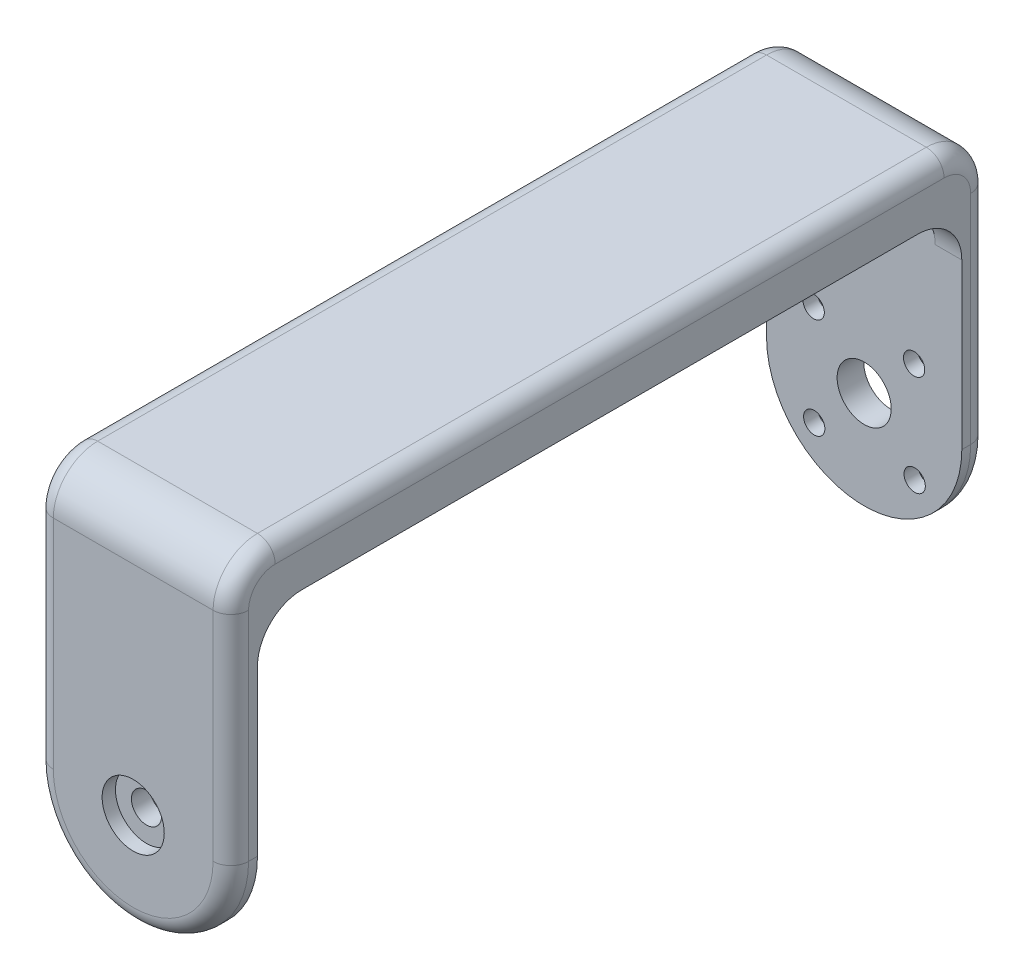
from build123d import *

# Parameters (mm, degrees)
ESBO_O1_R                                            = 3.05
RESSALTO_EXTRUS_O1_DEPTH                             = 3
ESBO_O2_W                                            = 22
ESBO_O2_H                                            = 82.35
RESSALTO_EXTRUS_O2_DEPTH                             = 3
RESSALTO_EXTRUS_O3_START                             = 3
RESSALTO_EXTRUS_O3_DEPTH                             = 3
ESBO_O6_W                                            = 85.35
ESBO_O6_H                                            = 6
RESSALTO_EXTRUS_O5_DEPTH                             = 3
ESBO_O7_R                                            = 2.75
RESSALTO_EXTRUS_O6_DEPTH                             = 0.6
REBAIXO_PARA_PARAFUSO_COM_CABE_A_PANELA_D            = 3.4
REBAIXO_PARA_PARAFUSO_COM_CABE_A_PANELA_CBORE_D      = 7
REBAIXO_PARA_PARAFUSO_COM_CABE_A_PANELA_CBORE_DEPTH  = 1.5
REBAIXO_PARA_PARAFUSO_COM_CABE_A_REDONDA_D           = 2.4
REBAIXO_PARA_PARAFUSO_COM_CABE_A_REDONDA_DEPTH       = 3
REBAIXO_PARA_PARAFUSO_COM_CABE_A_REDONDA_CBORE_D     = 4.4
REBAIXO_PARA_PARAFUSO_COM_CABE_A_REDONDA_CBORE_DEPTH = 1.4
PADR_OCIRCULAR1_COUNT                                = 4
FILETE1_R                                            = 5
FILETE2_R                                            = 5
FILETE3_R                                            = 2


with BuildPart() as part:
    # Esboço1 → Ressalto-extrusão1 (new body)
    with BuildSketch(Plane.XY):
        with BuildLine():
            Line((11, -1.428145739), (11, 25.071854261))
            Line((11, 25.071854261), (-11, 25.071854261))
            Line((-11, 25.071854261), (-11, -1.428145739))
            ThreePointArc((-11, -1.428145739), (0, -12.428145739), (11, -1.428145739))
        make_face()
        with Locations((0, -1.428145739)):
            Circle(ESBO_O1_R, mode=Mode.SUBTRACT)
    extrude(amount=-RESSALTO_EXTRUS_O1_DEPTH)

    # Esboço2 → Ressalto-extrusão2 (add)
    with BuildSketch(Plane(origin=(0, 25.071854261, 0), x_dir=(1, 0, 0), z_dir=(0, 1, 0))):
        with Locations((0, -38.175)):
            Rectangle(ESBO_O2_W, ESBO_O2_H)
    extrude(amount=RESSALTO_EXTRUS_O2_DEPTH)

    # Esboço3 → Ressalto-extrusão3 (add)
    with BuildSketch(Plane.XY.offset(79.35).offset(RESSALTO_EXTRUS_O3_START)):
        with BuildLine():
            Line((11, 28.071854261), (-11, 28.071854261))
            Line((-11, 28.071854261), (-11, -1.428145739))
            ThreePointArc((-11, -1.428145739), (0, -12.428145739), (11, -1.428145739))
            Line((11, -1.428145739), (11, 28.071854261))
        make_face()
    extrude(amount=-RESSALTO_EXTRUS_O3_DEPTH)

    # Esboço6 → Ressalto-extrusão5 (add)
    with BuildSketch(Plane(origin=(11, 0, 0), x_dir=(0, 0, -1), z_dir=(1, 0, 0))):
        with Locations((-39.675, 25.071854261)):
            Rectangle(ESBO_O6_W, ESBO_O6_H)
    ressalto_extrus_o5 = extrude(amount=-RESSALTO_EXTRUS_O5_DEPTH)

    # Espelhar1: Ressalto-extrusão5 across plane
    add(ressalto_extrus_o5.mirror(Plane(origin=(0, 0, 0), x_dir=(0, 0, 1), z_dir=(1, 0, 0))))

    # Esboço7 → Ressalto-extrusão6 (add)
    with BuildSketch(Plane(origin=(0, 0, 79.35), x_dir=(-1, 0, 0), z_dir=(0, 0, -1))):
        with Locations(Location((0, -1.428145739, 0), (0, 0, 180))):
            Circle(ESBO_O7_R)
    extrude(amount=RESSALTO_EXTRUS_O6_DEPTH)

    # Rebaixo para parafuso com cabeça panela de M31 (through all)
    with Locations(Plane.XY.offset(82.35)):
        with Locations((0, -1.428145739)):
            CounterBoreHole(REBAIXO_PARA_PARAFUSO_COM_CABE_A_PANELA_D / 2, REBAIXO_PARA_PARAFUSO_COM_CABE_A_PANELA_CBORE_D / 2, REBAIXO_PARA_PARAFUSO_COM_CABE_A_PANELA_CBORE_DEPTH)

    # Rebaixo para parafuso com cabeça redonda de M21
    with Locations(Plane(origin=(0, 0, -3), x_dir=(-1, 0, 0), z_dir=(0, 0, -1))):
        with Locations((-5.624741587, 4.260639903)):
            rebaixo_para_parafuso_com_cabe_a_redonda = CounterBoreHole(REBAIXO_PARA_PARAFUSO_COM_CABE_A_REDONDA_D / 2, REBAIXO_PARA_PARAFUSO_COM_CABE_A_REDONDA_CBORE_D / 2, REBAIXO_PARA_PARAFUSO_COM_CABE_A_REDONDA_CBORE_DEPTH, depth=REBAIXO_PARA_PARAFUSO_COM_CABE_A_REDONDA_DEPTH)

    # PadrãoCircular1: Rebaixo para parafuso com cabeça redonda de M21 ×4 about axis
    padr_ocircular1_axis = Axis((0, -1.428145739, 0), (0, 0, 1))
    for i in range(1, PADR_OCIRCULAR1_COUNT):
        add(rebaixo_para_parafuso_com_cabe_a_redonda.rotate(padr_ocircular1_axis, i * 360 / PADR_OCIRCULAR1_COUNT), mode=Mode.SUBTRACT)

    # Filete1
    filete1_edges = [part.edges().sort_by_distance(p)[0] for p in [
        (0, 25.071854261, 0),
        (0, 25.071854261, 79.35),
        (0, 28.071854261, -3),
        (0, 28.071854261, 82.35),
    ]]
    fillet(filete1_edges, radius=FILETE1_R)

    # Filete2
    # the kernel refuses this fillet: 5 mm, written as the material it adds along each edge
    with BuildSketch(Plane(origin=(11, 22.071854261, 0.417424305), x_dir=(0, -0.9965332502141475, -0.0831954398848114), z_dir=(-1, 0, 0)), Plane(origin=(-11, 22.071854261, 78.932575695), x_dir=(0, -0.9965332502141476, 0.0831954398848087), z_dir=(1, 0, 0))) as filete2_piece_1:
        with BuildLine():
            CenterArc((4.60141685, 4.982666251), FILETE2_R, 184.772263604, 90)
            Line((-0.381249401, 4.566689052), (-0.879516026, 4.525091332))
            Line((-0.879516026, 4.525091332), (-0.498266625, -0.04159772))
            Line((-0.498266625, -0.04159772), (-0.16118171, -0.473307993))
            ThreePointArc((-0.16118171, -0.473307993), (2.069392019, -0.747852945), (5.05899177, -0.498266625))
            Line((5.05899177, -0.498266625), (5.01739405, 0))
        make_face()
    extrude(amount=3)
    with BuildSketch(Plane(origin=(-11, 22.071854261, 0.417424305), x_dir=(0, -0.9965332502141475, -0.08319543988481146), z_dir=(1, 0, 0))) as filete2_piece_2:
        with BuildLine():
            CenterArc((4.60141685, -4.982666251), FILETE2_R, 85.227736396, 90)
            Line((-0.381249401, -4.566689052), (-0.879516026, -4.525091332))
            Line((-0.879516026, -4.525091332), (-0.498266625, 0.04159772))
            Line((-0.498266625, 0.04159772), (-0.16118171, 0.473307993))
            ThreePointArc((-0.16118171, 0.473307993), (2.069392019, 0.747852945), (5.05899177, 0.498266625))
            Line((5.05899177, 0.498266625), (5.01739405, 0))
        make_face()
    extrude(amount=3)
    with BuildSketch(Plane(origin=(11, 22.071854261, 78.932575695), x_dir=(0, 0, -1), z_dir=(-1, 0, 0))) as filete2_piece_3:
        with BuildLine():
            CenterArc((4.582575695, 5), FILETE2_R, 180, 90)
            Line((-0.417424305, 5), (-0.917424305, 5))
            ThreePointArc((-0.917424305, 5), (-0.917424305, 2), (-0.458257569, -0.2))
            Line((-0.458257569, -0.2), (0, -0.5))
            Line((0, -0.5), (4.582575695, -0.5))
            Line((4.582575695, -0.5), (4.582575695, 0))
        make_face()
    extrude(amount=3)

    # Filete3
    # the kernel refuses this fillet: 2 mm, written as the material it takes off along each edge
    with BuildSketch(Plane(origin=(-11, 28.071854261, 2), x_dir=(1, 0, 0), z_dir=(0, 0, 1))) as filete3_piece_1:
        with BuildLine():
            CenterArc((FILETE3_R, -FILETE3_R), FILETE3_R, 90, 90)
            Line((0, -FILETE3_R), (0, 0))
            Line((0, 0), (FILETE3_R, 0))
        make_face()
    extrude(amount=75.35, mode=Mode.SUBTRACT)
    with BuildSketch(Plane(origin=(11, 28.071854261, 2), x_dir=(-1, 0, 0), z_dir=(0, 0, 1))) as filete3_piece_2:
        with BuildLine():
            CenterArc((FILETE3_R, FILETE3_R), FILETE3_R, 180, 90)
            Line((0, FILETE3_R), (0, 0))
            Line((0, 0), (FILETE3_R, 0))
        make_face()
    extrude(amount=75.35, mode=Mode.SUBTRACT)
    with BuildSketch(Plane(origin=(-11, -1.428145739, -3), x_dir=(1, 0, 0), z_dir=(0, 1, 0)), Plane(origin=(-11, 23.071854261, 82.35), x_dir=(1, 0, 0), z_dir=(0, -1, 0))) as filete3_piece_3:
        with BuildLine():
            CenterArc((FILETE3_R, -FILETE3_R), FILETE3_R, 90, 90)
            Line((0, -FILETE3_R), (0, 0))
            Line((0, 0), (FILETE3_R, 0))
        make_face()
    extrude(amount=24.5, mode=Mode.SUBTRACT)
    with BuildSketch(Plane(origin=(-11, 23.071854261, 77.35), x_dir=(0, 1, 0), z_dir=(0, 0, -1))) as filete3_piece_4:
        with BuildLine():
            CenterArc((5 - FILETE3_R, FILETE3_R), FILETE3_R, 270, 90)
            Line((5 - FILETE3_R, 0), (5, 0))
            Line((5, 0), (5, FILETE3_R))
        make_face()
    revolve(axis=Axis((-11, 23.071854261, 77.35), (1, 0, 0)), revolution_arc=90, mode=Mode.SUBTRACT)
    with BuildSketch(Plane(origin=(-11, 23.071854261, 2), x_dir=(0, 0, -1), z_dir=(0, -1, 0))) as filete3_piece_5:
        with BuildLine():
            CenterArc((5 - FILETE3_R, FILETE3_R), FILETE3_R, 270, 90)
            Line((5 - FILETE3_R, 0), (5, 0))
            Line((5, 0), (5, FILETE3_R))
        make_face()
    revolve(axis=Axis((-11, 23.071854261, 2), (1, 0, 0)), revolution_arc=90, mode=Mode.SUBTRACT)
    with BuildSketch(Plane(origin=(11, 23.071854261, 77.35), x_dir=(0, 1, 0), z_dir=(0, 0, -1))) as filete3_piece_6:
        with BuildLine():
            CenterArc((5 - FILETE3_R, -FILETE3_R), FILETE3_R, 0, 90)
            Line((5 - FILETE3_R, 0), (5, 0))
            Line((5, 0), (5, -FILETE3_R))
        make_face()
    revolve(axis=Axis((11, 23.071854261, 77.35), (1, 0, 0)), revolution_arc=90, mode=Mode.SUBTRACT)
    with BuildSketch(Plane(origin=(11, 23.071854261, 2), x_dir=(0, 0, -1), z_dir=(0, -1, 0))) as filete3_piece_7:
        with BuildLine():
            CenterArc((5 - FILETE3_R, -FILETE3_R), FILETE3_R, 0, 90)
            Line((5 - FILETE3_R, 0), (5, 0))
            Line((5, 0), (5, -FILETE3_R))
        make_face()
    revolve(axis=Axis((11, 23.071854261, 2), (1, 0, 0)), revolution_arc=90, mode=Mode.SUBTRACT)
    with BuildSketch(Plane(origin=(11, 23.071854261, 82.35), x_dir=(-1, 0, 0), z_dir=(0, -1, 0)), Plane(origin=(11, -1.428145739, -3), x_dir=(-1, 0, 0), z_dir=(0, 1, 0))) as filete3_piece_8:
        with BuildLine():
            CenterArc((FILETE3_R, FILETE3_R), FILETE3_R, 180, 90)
            Line((0, FILETE3_R), (0, 0))
            Line((0, 0), (FILETE3_R, 0))
        make_face()
    extrude(amount=24.5, mode=Mode.SUBTRACT)
    with BuildSketch(Plane(origin=(0, -1.428145739, 82.35), x_dir=(-1, 0, 0), z_dir=(0, 1, 0))) as filete3_piece_9:
        with BuildLine():
            CenterArc((11 - FILETE3_R, -FILETE3_R), FILETE3_R, 0, 90)
            Line((11, -FILETE3_R), (11, 0))
            Line((11, 0), (11 - FILETE3_R, 0))
        make_face()
    revolve(axis=Axis((0, -1.428145739, 82.35), (0, 0, 1)), revolution_arc=180, mode=Mode.SUBTRACT)
    with BuildSketch(Plane(origin=(0, -1.428145739, -3), x_dir=(-1, 0, 0), z_dir=(0, 1, 0))) as filete3_piece_10:
        with BuildLine():
            CenterArc((11 - FILETE3_R, FILETE3_R), FILETE3_R, 270, 90)
            Line((11, FILETE3_R), (11, 0))
            Line((11, 0), (11 - FILETE3_R, 0))
        make_face()
    revolve(axis=Axis((0, -1.428145739, -3), (0, 0, 1)), revolution_arc=180, mode=Mode.SUBTRACT)


solid = part.part
